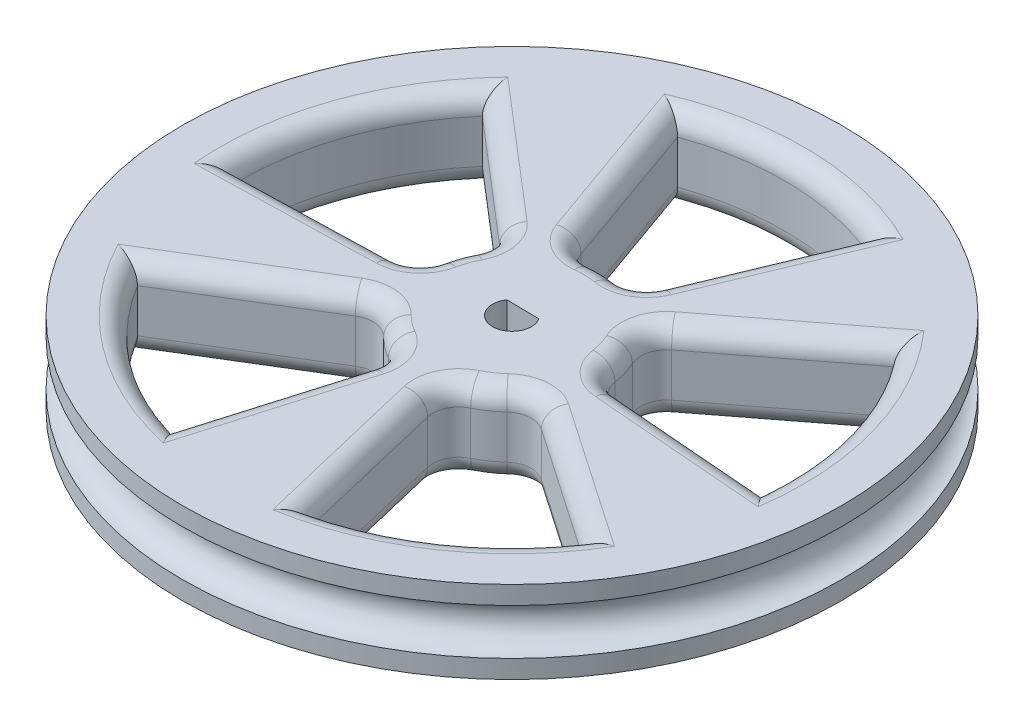
from build123d import *

# Parameters (mm, degrees)
SKETCH1_R           = 25.4
BOSS_EXTRUDE1_DEPTH = 6.35
SKETCH3_R           = 1.7653000000000019
FILLET1_R           = 1.5
FILLET5_R           = 1.5


with BuildPart() as part:
    # Sketch1 → Boss-Extrude1 (new body)
    with BuildSketch(Plane(origin=(0, 0, 0), x_dir=(1, 0, 0), z_dir=(0, 1, 0))):
        with Locations(Location((0, 0, 0), (0, 0, 270))):
            Circle(SKETCH1_R)
        with BuildLine():
            Line((-1.239214046451143, 0.8451914262924021), (1.263436215829662, 0.8085350508976246))
            ThreePointArc((1.263436215829662, 0.8085350508976246), (-0.02196817781749697, -1.4998391244274765), (-1.239214046451143, 0.8451914262924021))
        make_face(mode=Mode.SUBTRACT)
        with BuildLine():
            Line((6.957562998546382, 5.347178426166307), (16.65064569144089, 12.796718253447914))
            ThreePointArc((16.65064569144089, 12.796718253447914), (20.137394289136008, 5.956958220761493), (20.932776346026767, -1.6789504004727618))
            Line((20.932776346026767, -1.6789504004727618), (8.746874617410656, -0.7015585701117318))
            ThreePointArc((8.746874617410656, -0.7015585701117318), (7.538548422866684, -0.16671267846281812), (6.927491398762463, 1.0049193599891764))
            ThreePointArc((6.927491398762463, 1.0049193599891764), (6.712464763045756, 1.9856527402539574), (6.359342943569763, 2.925535391356313))
            ThreePointArc((6.359342943569763, 2.925535391356313), (6.2346640954479655, 4.241045750519349), (6.957562998546382, 5.347178426166307))
        make_face(mode=Mode.SUBTRACT)
        with BuildLine():
            Line((-2.9354636800132026, 8.269404632942047), (-7.02506979616333, 19.7901084979096))
            ThreePointArc((-7.02506979616333, 19.7901084979096), (0.5573931246188307, 20.99260138488386), (8.065360349277938, 19.389429141578542))
            Line((8.065360349277938, 19.389429141578542), (3.370154754114209, 8.101978581391178))
            ThreePointArc((3.370154754114209, 8.101978581391178), (2.4880927547856215, 7.118068550150576), (1.184977464934863, 6.898972996584096))
            ThreePointArc((1.184977464934863, 6.898972996584096), (0.1857977082062769, 6.997533794961285), (-0.8172044549799278, 6.952134699411467))
            ThreePointArc((-0.8172044549799278, 6.952134699411467), (-2.1068570372248887, 7.240073125718787), (-2.9354636800132026, 8.269404632942047))
        make_face(mode=Mode.SUBTRACT)
        with BuildLine():
            Line((7.235474091984142, -4.96466662166111), (17.31573476810607, -11.881301672822806))
            ThreePointArc((17.31573476810607, -11.881301672822806), (11.888200990925402, -17.31099873489043), (4.871806911466461, -20.42707755449627))
            Line((4.871806911466461, -20.42707755449627), (2.0357110547792607, -8.535565622819002))
            ThreePointArc((2.0357110547792607, -8.535565622819002), (2.1709863963831397, -7.22110265179649), (3.09644767627299, -6.277898676158374))
            ThreePointArc((3.09644767627299, -6.277898676158374), (3.962733663642219, -5.770332911630332), (4.747494540223225, -5.14405439226292))
            ThreePointArc((4.747494540223225, -5.14405439226292), (5.960091356650591, -4.618962704054631), (7.235474091984142, -4.96466662166111))
        make_face(mode=Mode.SUBTRACT)
        with BuildLine():
            Line((-2.4857940849808533, -8.415511141165377), (-5.948933064572476, -20.13976651784332))
            ThreePointArc((-5.948933064572476, -20.13976651784332), (-12.79008201165348, -16.65574381813031), (-17.921834088113528, -10.945677819036153))
            Line((-17.921834088113528, -10.945677819036153), (-7.488735994283184, -4.573711097995527))
            ThreePointArc((-7.488735994283184, -4.573711097995527), (-6.196805040788158, -4.296174196598862), (-5.013781490439832, -4.884874119782712))
            ThreePointArc((-5.013781490439832, -4.884874119782712), (-4.2633606705510445, -5.551914606043445), (-3.425229956306851, -6.104735845753053))
            ThreePointArc((-3.425229956306851, -6.104735845753053), (-2.5511250609829195, -7.095721694393666), (-2.4857940849808533, -8.415511141165377))
        make_face(mode=Mode.SUBTRACT)
        with BuildLine():
            Line((-8.771779325535338, -0.23640529628257928), (-20.99237759880964, -0.5657585606915596))
            ThreePointArc((-20.99237759880964, -0.5657585606915596), (-19.792906393025493, 7.017182947375003), (-15.94810951865652, 13.662276632426137))
            Line((-15.94810951865652, 13.662276632426137), (-6.664004432020967, 5.708856709535186))
            ThreePointArc((-6.664004432020967, 5.708856709535186), (-6.000822533246314, 4.565920976708062), (-6.195135049529354, 3.2588804393676236))
            ThreePointArc((-6.195135049529354, 3.2588804393676236), (-6.597635464341803, 2.339060982458413), (-6.864403072504624, 1.3711201472478967))
            ThreePointArc((-6.864403072504624, 1.3711201472478967), (-7.536773353889203, 0.233565522209511), (-8.771779325535338, -0.23640529628257928))
        make_face(mode=Mode.SUBTRACT)
    extrude(amount=BOSS_EXTRUDE1_DEPTH)

    # Sketch3 → Cut-Revolve3 (revolve, cut)
    with BuildSketch(Plane(origin=(0, 0, 0), x_dir=(0.8245587984812139, 0, 0.5657762701344207), z_dir=(-0.5657762701344207, 0, 0.8245587984812139)), mode=Mode.PRIVATE) as cut_revolve3_sk:
        with Locations((-25.399999999999995, 3.175)):
            Circle(SKETCH3_R)
    revolve(cut_revolve3_sk.sketch.rotate(Axis((0, 6.41804163245562, 0), (0, -1, 0)), 235.543785728), axis=Axis((0, 6.41804163245562, 0), (0, -1, 0)), mode=Mode.SUBTRACT)

    # Fillet1
    # the kernel refuses this fillet: 1.5 mm, written as the material it takes off along each edge
    with BuildSketch(Plane(origin=(1.5235424549162517, 6.35, -8.870108138465268), x_dir=(0.9233061495989783, 0, 0.38406477853704474), z_dir=(0.38406477853704474, 0, -0.9233061495989783))) as fillet1_piece_1:
        with BuildLine():
            CenterArc((2.0000000000000018 + FILLET1_R, FILLET1_R), FILLET1_R, 180, 90)
            Line((2.0000000000000018 + FILLET1_R, 0), (2.0000000000000018, 0))
            Line((2.0000000000000018, 0), (2.0000000000000013, FILLET1_R))
        make_face()
    revolve(axis=Axis((1.5235424549162517, 6.35, -8.870108138465268), (0, -1, 0)), revolution_arc=77.16041159309582, mode=Mode.SUBTRACT)
    with BuildSketch(Plane(origin=(9.505603268791855, 6.35, -22.85182720257471), x_dir=(0, -1, 0), z_dir=(-0.3840647785370448, 0, 0.9233061495989783))) as fillet1_piece_2_section:
        with BuildLine():
            CenterArc((FILLET1_R, FILLET1_R), FILLET1_R, 180, 90)
            Line((0, FILLET1_R), (0, 0))
            Line((0, 0), (FILLET1_R, 0))
        make_face()
    fillet1_piece_2 = extrude(amount=15.975035612607877, mode=Mode.PRIVATE)
    fillet1_piece_2 = fillet1_piece_2 & Plane(origin=(-2.44e-15, 6.010300886123182, -2.132e-14), x_dir=(-0.334527133150635, 0, -0.9423861189480761), z_dir=(0, -1, 0)) * Cylinder(20.999999999999982, 38, mode=Mode.PRIVATE)
    add(fillet1_piece_2, mode=Mode.SUBTRACT)
    with BuildSketch(Plane(origin=(-2.44e-15, 6.35, -2.132e-14), x_dir=(-0.334527133150635, 0, -0.9423861189480761), z_dir=(-0.9423861189480761, 0, 0.334527133150635))) as fillet1_piece_3:
        with BuildLine():
            CenterArc((20.999999999999986 + FILLET1_R, FILLET1_R), FILLET1_R, 180, 90)
            Line((20.999999999999986 + FILLET1_R, 0), (20.999999999999986, 0))
            Line((20.999999999999986, 0), (20.999999999999986, FILLET1_R))
        make_face()
    revolve(axis=Axis((-2.44e-15, 6.35, -2.132e-14), (0, -1, 0)), revolution_arc=42.12947856562085, mode=Mode.SUBTRACT)
    with BuildSketch(Plane(origin=(-2.9354636800132026, 6.35, -8.269404632942047), x_dir=(0, -1, 0), z_dir=(-0.3345271331506348, 0, -0.9423861189480762))) as fillet1_piece_4_section:
        with BuildLine():
            CenterArc((FILLET1_R, FILLET1_R), FILLET1_R, 180, 90)
            Line((0, FILLET1_R), (0, 0))
            Line((0, 0), (FILLET1_R, 0))
        make_face()
    fillet1_piece_4 = extrude(amount=15.975035612607877, mode=Mode.PRIVATE)
    fillet1_piece_4 = fillet1_piece_4 & Plane(origin=(-2.44e-15, 6.0102984856456505, -2.132e-14), x_dir=(-0.334527133150635, 0, -0.9423861189480761), z_dir=(0, -1, 0)) * Cylinder(20.999999999999982, 38, mode=Mode.PRIVATE)
    add(fillet1_piece_4, mode=Mode.SUBTRACT)
    with BuildSketch(Plane(origin=(-1.0506914421170503, 6.35, -8.938458899243313), x_dir=(0.11674349356856133, 0, 0.9931620999159237), z_dir=(0.9931620999159237, 0, -0.11674349356856133))) as fillet1_piece_5:
        with BuildLine():
            CenterArc((1.9999999999999993 + FILLET1_R, FILLET1_R), FILLET1_R, 180, 90)
            Line((1.9999999999999993 + FILLET1_R, 0), (1.9999999999999993, 0))
            Line((1.9999999999999993, 0), (1.9999999999999993, FILLET1_R))
        make_face()
    revolve(axis=Axis((-1.0506914421170503, 6.35, -8.938458899243313), (0, -1, 0)), revolution_arc=77.16041159309594, mode=Mode.SUBTRACT)
    with BuildSketch(Plane(origin=(-6.44e-15, 6.35, 1.4166e-13), x_dir=(0.1692824949906922, 0, -0.9855675709405857), z_dir=(0.9855675709405857, 0, 0.1692824949906922))) as fillet1_piece_6:
        with BuildLine():
            CenterArc((7.000000000000141 - FILLET1_R, -FILLET1_R), FILLET1_R, 0, 90)
            Line((7.000000000000141 - FILLET1_R, 0), (7.000000000000141, 0))
            Line((7.000000000000141, 0), (7.000000000000141, -FILLET1_R))
        make_face()
    revolve(axis=Axis((-6.44e-15, 6.35, 1.4166e-13), (0, 1, 0)), revolution_arc=16.450301751812173, mode=Mode.SUBTRACT)
    with BuildSketch(Plane(origin=(8.906774655552294, 6.35, -1.292039177129571), x_dir=(-0.07995001907078597, 0, 0.9967988736202409), z_dir=(0.9967988736202409, 0, 0.07995001907078597))) as fillet1_piece_7:
        with BuildLine():
            CenterArc((2.0000000000008233 + FILLET1_R, FILLET1_R), FILLET1_R, 180, 90)
            Line((2.0000000000008233 + FILLET1_R, 0), (2.0000000000008233, 0))
            Line((2.0000000000008233, 0), (2.0000000000008233, FILLET1_R))
        make_face()
    revolve(axis=Axis((8.906774655552294, 6.35, -1.292039177129571), (0, -1, 0)), revolution_arc=77.16041159304291, mode=Mode.SUBTRACT)
    with BuildSketch(Plane(origin=(24.670772122102868, 6.35, 1.978762971985738), x_dir=(-2e-17, -1, 2.9e-16), z_dir=(-0.9967988736202938, 0, -0.07995001907012703))) as fillet1_piece_8_section:
        with BuildLine():
            CenterArc((FILLET1_R, FILLET1_R), FILLET1_R, 180, 90)
            Line((4.4e-16, FILLET1_R), (0, 0))
            Line((0, 0), (FILLET1_R, 0))
        make_face()
    fillet1_piece_8 = extrude(amount=15.975035612608481, mode=Mode.PRIVATE)
    fillet1_piece_8 = fillet1_piece_8 & Plane(origin=(-7.638e-14, 6.010300885898261, -1.11e-15), x_dir=(0.7928878900685917, 0, -0.6093675358784523), z_dir=(0, -1, 0)) * Cylinder(21.00000000000068, 38, mode=Mode.PRIVATE)
    add(fillet1_piece_8, mode=Mode.SUBTRACT)
    with BuildSketch(Plane(origin=(-7.638e-14, 6.35, -1.11e-15), x_dir=(0.7928878900685917, 0, -0.6093675358784523), z_dir=(-0.6093675358784523, 0, -0.7928878900685917))) as fillet1_piece_9:
        with BuildLine():
            CenterArc((21.00000000000068 + FILLET1_R, FILLET1_R), FILLET1_R, 180, 90)
            Line((21.00000000000068 + FILLET1_R, 0), (21.00000000000068, 0))
            Line((21.00000000000068, 0), (21.000000000000682, FILLET1_R))
        make_face()
    revolve(axis=Axis((-7.638e-14, 6.35, -1.11e-15), (0, -1, 0)), revolution_arc=42.129478565620666, mode=Mode.SUBTRACT)
    with BuildSketch(Plane(origin=(6.957562998546382, 6.35, -5.347178426166307), x_dir=(0, -1, 0), z_dir=(0.792887890068589, 0, -0.6093675358784559))) as fillet1_piece_10_section:
        with BuildLine():
            CenterArc((FILLET1_R, FILLET1_R), FILLET1_R, 180.00000000000003, 90)
            Line((0, FILLET1_R), (0, 0))
            Line((0, 0), (FILLET1_R, 0))
        make_face()
    fillet1_piece_10 = extrude(amount=15.975035612608496, mode=Mode.PRIVATE)
    fillet1_piece_10 = fillet1_piece_10 & Plane(origin=(-7.638e-14, 6.010298485645654, -1.11e-15), x_dir=(0.7928878900685917, 0, -0.6093675358784523), z_dir=(0, -1, 0)) * Cylinder(21.00000000000068, 38, mode=Mode.PRIVATE)
    add(fillet1_piece_10, mode=Mode.SUBTRACT)
    with BuildSketch(Plane(origin=(8.176298070304803, 6.35, -3.7614026460292664), x_dir=(-0.9084775633671516, 0, 0.4179336273363071), z_dir=(0.4179336273363071, 0, 0.9084775633671516))) as fillet1_piece_11:
        with BuildLine():
            CenterArc((2.000000000000812 + FILLET1_R, FILLET1_R), FILLET1_R, 180, 90)
            Line((2.000000000000812 + FILLET1_R, 0), (2.000000000000812, 0))
            Line((2.000000000000812, 0), (2.0000000000008114, FILLET1_R))
        make_face()
    revolve(axis=Axis((8.176298070304803, 6.35, -3.7614026460292664), (0, -1, 0)), revolution_arc=77.16041159304235, mode=Mode.SUBTRACT)
    with BuildSketch(Plane(origin=(4.4365e-13, 6.35, -1.0747e-13), x_dir=(0.9896416283945478, 0, -0.14355990856986317), z_dir=(0.14355990856986317, 0, 0.9896416283945478))) as fillet1_piece_12:
        with BuildLine():
            CenterArc((7.000000000000185 - FILLET1_R, -FILLET1_R), FILLET1_R, 0, 90)
            Line((7.000000000000185 - FILLET1_R, 0), (7.000000000000185, 0))
            Line((7.000000000000185, 0), (7.000000000000185, -FILLET1_R))
        make_face()
    revolve(axis=Axis((4.4365e-13, 6.35, -1.0747e-13), (0, 1, 0)), revolution_arc=16.450301751814376, mode=Mode.SUBTRACT)
    with BuildSketch(Plane(origin=(3.981147012351228, 6.35, 8.071584012204102), x_dir=(-0.9727179787856489, 0, 0.23199080530736996), z_dir=(0.23199080530736996, 0, 0.9727179787856489))) as fillet1_piece_13:
        with BuildLine():
            CenterArc((2.0000000000006883 + FILLET1_R, FILLET1_R), FILLET1_R, 180, 90)
            Line((2.0000000000006883 + FILLET1_R, 0), (2.0000000000006883, 0))
            Line((2.0000000000006883, 0), (2.0000000000006883, FILLET1_R))
        make_face()
    revolve(axis=Axis((3.981147012351228, 6.35, 8.071584012204102), (0, -1, 0)), revolution_arc=77.16041159306168, mode=Mode.SUBTRACT)
    with BuildSketch(Plane(origin=(5.741772431371222, 6.35, 24.074769974941947), x_dir=(0, -1, 0), z_dir=(-0.23199080530793634, 0, -0.9727179787855138))) as fillet1_piece_14_section:
        with BuildLine():
            CenterArc((FILLET1_R, FILLET1_R), FILLET1_R, 180, 90)
            Line((0, FILLET1_R), (0, 0))
            Line((0, 0), (FILLET1_R, 0))
        make_face()
    fillet1_piece_14 = extrude(amount=15.9750356126083, mode=Mode.PRIVATE)
    fillet1_piece_14 = fillet1_piece_14 & Plane(origin=(-1.199e-13, 6.010301653620329, -2.6734e-13), x_dir=(0.8245587984812192, 0, 0.565776270134413), z_dir=(0, -1, 0)) * Cylinder(21.00000000000071, 38, mode=Mode.PRIVATE)
    add(fillet1_piece_14, mode=Mode.SUBTRACT)
    with BuildSketch(Plane(origin=(-1.199e-13, 6.35, -2.6734e-13), x_dir=(0.8245587984812192, 0, 0.565776270134413), z_dir=(0.565776270134413, 0, -0.8245587984812192))) as fillet1_piece_15:
        with BuildLine():
            CenterArc((21.000000000000714 + FILLET1_R, FILLET1_R), FILLET1_R, 180, 90)
            Line((21.000000000000714 + FILLET1_R, 0), (21.000000000000714, 0))
            Line((21.000000000000714, 0), (21.000000000000714, FILLET1_R))
        make_face()
    revolve(axis=Axis((-1.199e-13, 6.35, -2.6734e-13), (0, -1, 0)), revolution_arc=42.129478565620346, mode=Mode.SUBTRACT)
    with BuildSketch(Plane(origin=(7.235474091984142, 6.35, 4.96466662166111), x_dir=(0, -1, 0), z_dir=(0.8245587984812139, 0, 0.5657762701344207))) as fillet1_piece_16_section:
        with BuildLine():
            CenterArc((FILLET1_R, FILLET1_R), FILLET1_R, 180, 90)
            Line((0, FILLET1_R), (0, 0))
            Line((0, 0), (FILLET1_R, 0))
        make_face()
    fillet1_piece_16 = extrude(amount=15.97503561260779, mode=Mode.PRIVATE)
    fillet1_piece_16 = fillet1_piece_16 & Plane(origin=(-1.199e-13, 6.0102984856456505, -2.6734e-13), x_dir=(0.8245587984812192, 0, 0.565776270134413), z_dir=(0, -1, 0)) * Cylinder(21.00000000000071, 38, mode=Mode.PRIVATE)
    add(fillet1_piece_16, mode=Mode.SUBTRACT)
    with BuildSketch(Plane(origin=(6.103921551715461, 6.35, 6.613784218623904), x_dir=(-0.6782135057460461, 0, -0.7348649131804144), z_dir=(-0.7348649131804144, 0, 0.6782135057460461))) as fillet1_piece_17:
        with BuildLine():
            CenterArc((2.000000000000212 + FILLET1_R, FILLET1_R), FILLET1_R, 180, 90)
            Line((2.000000000000212 + FILLET1_R, 0), (2.000000000000212, 0))
            Line((2.000000000000212, 0), (2.000000000000212, FILLET1_R))
        make_face()
    revolve(axis=Axis((6.103921551715461, 6.35, 6.613784218623904), (0, -1, 0)), revolution_arc=77.16041159308413, mode=Mode.SUBTRACT)
    with BuildSketch(Plane(origin=(-2.23044e-12, 6.35, -3.82094e-12), x_dir=(0.44234966803900455, 0, 0.8968426680225369), z_dir=(-0.8968426680225369, 0, 0.44234966803900455))) as fillet1_piece_18:
        with BuildLine():
            CenterArc((7.000000000004946 - FILLET1_R, -FILLET1_R), FILLET1_R, 0, 90)
            Line((7.000000000004946 - FILLET1_R, 0), (7.000000000004946, 0))
            Line((7.000000000004946, 0), (7.000000000004946, -FILLET1_R))
        make_face()
    revolve(axis=Axis((-2.23044e-12, 6.35, -3.82094e-12), (0, 1, 0)), revolution_arc=16.45030175180311, mode=Mode.SUBTRACT)
    with BuildSketch(Plane(origin=(-6.446290487708355, 6.35, 6.280552439720628), x_dir=(-0.5212227532874149, 0, -0.8534206708625511), z_dir=(-0.8534206708625511, 0, 0.5212227532874149))) as fillet1_piece_19:
        with BuildLine():
            CenterArc((1.9999999999999993 + FILLET1_R, FILLET1_R), FILLET1_R, 180, 90)
            Line((1.9999999999999993 + FILLET1_R, 0), (1.9999999999999993, 0))
            Line((1.9999999999999993, 0), (1.9999999999999993, FILLET1_R))
        make_face()
    revolve(axis=Axis((-6.446290487708355, 6.35, 6.280552439720628), (0, -1, 0)), revolution_arc=77.16041159309594, mode=Mode.SUBTRACT)
    with BuildSketch(Plane(origin=(-21.122161603848028, 6.35, 12.900263143864064), x_dir=(5.3e-16, -1, 8.6e-16), z_dir=(0.8534206708625337, 0, -0.5212227532874435))) as fillet1_piece_20_section:
        with BuildLine():
            CenterArc((FILLET1_R, FILLET1_R), FILLET1_R, 180, 90.00000000000006)
            Line((-1.52e-15, FILLET1_R), (0, 0))
            Line((0, 0), (FILLET1_R, 0))
        make_face()
    fillet1_piece_20 = extrude(amount=15.975035612608073, mode=Mode.PRIVATE)
    fillet1_piece_20 = fillet1_piece_20 & Plane(origin=(-2.0961e-13, 6.010301653620333, 1.8829e-13), x_dir=(-0.28328252688439476, 0, 0.9590365008496768), z_dir=(0, -1, 0)) * Cylinder(20.999999999999915, 38, mode=Mode.PRIVATE)
    add(fillet1_piece_20, mode=Mode.SUBTRACT)
    with BuildSketch(Plane(origin=(-2.0961e-13, 6.35, 1.8829e-13), x_dir=(-0.28328252688439476, 0, 0.9590365008496768), z_dir=(0.9590365008496768, 0, 0.28328252688439476))) as fillet1_piece_21:
        with BuildLine():
            CenterArc((20.999999999999915 + FILLET1_R, FILLET1_R), FILLET1_R, 180, 90)
            Line((20.999999999999915 + FILLET1_R, 0), (20.999999999999915, 0))
            Line((20.999999999999915, 0), (20.999999999999915, FILLET1_R))
        make_face()
    revolve(axis=Axis((-2.0961e-13, 6.35, 1.8829e-13), (0, -1, 0)), revolution_arc=42.129478565622115, mode=Mode.SUBTRACT)
    with BuildSketch(Plane(origin=(-2.4857940849808533, 6.35, 8.415511141165377), x_dir=(-2.7e-16, -1, -8e-17), z_dir=(-0.2832825268844254, 0, 0.9590365008496677))) as fillet1_piece_22_section:
        with BuildLine():
            CenterArc((FILLET1_R, FILLET1_R), FILLET1_R, 180.00000000000003, 90)
            Line((-4.3e-16, FILLET1_R), (0, 0))
            Line((0, 0), (FILLET1_R, 0))
        make_face()
    fillet1_piece_22 = extrude(amount=15.97503561260778, mode=Mode.PRIVATE)
    fillet1_piece_22 = fillet1_piece_22 & Plane(origin=(-2.0961e-13, 6.01030096790659, 1.8829e-13), x_dir=(-0.28328252688439476, 0, 0.9590365008496768), z_dir=(0, -1, 0)) * Cylinder(20.999999999999915, 38, mode=Mode.PRIVATE)
    add(fillet1_piece_22, mode=Mode.SUBTRACT)
    with BuildSketch(Plane(origin=(-4.403867086680483, 6.35, 7.848946087396787), x_dir=(0.4893185651867653, 0, -0.8721051208217765), z_dir=(-0.8721051208217765, 0, -0.4893185651867653))) as fillet1_piece_23:
        with BuildLine():
            CenterArc((2.000000000000208 + FILLET1_R, FILLET1_R), FILLET1_R, 180, 90)
            Line((2.000000000000208 + FILLET1_R, 0), (2.000000000000208, 0))
            Line((2.000000000000208, 0), (2.000000000000208, FILLET1_R))
        make_face()
    revolve(axis=Axis((-4.403867086680483, 6.35, 7.848946087396787), (0, -1, 0)), revolution_arc=77.16041159308432, mode=Mode.SUBTRACT)
    with BuildSketch(Plane(origin=(9.43978e-12, 6.35, -1.061506e-11), x_dir=(-0.7162544986341606, 0, 0.697839159969063), z_dir=(-0.697839159969063, 0, -0.7162544986341606))) as fillet1_piece_24:
        with BuildLine():
            CenterArc((7.000000000014168 - FILLET1_R, -FILLET1_R), FILLET1_R, 0, 90)
            Line((7.000000000014168 - FILLET1_R, 0), (7.000000000014168, 0))
            Line((7.000000000014168, 0), (7.000000000014168, -FILLET1_R))
        make_face()
    revolve(axis=Axis((9.43978e-12, 6.35, -1.061506e-11), (0, 1, 0)), revolution_arc=16.450301751783933, mode=Mode.SUBTRACT)
    with BuildSketch(Plane(origin=(-7.965173635109171, 6.35, -4.189989136329801), x_dir=(0.6505846015441016, 0, -0.7594337866026916), z_dir=(-0.7594337866026916, 0, -0.6505846015441016))) as fillet1_piece_25:
        with BuildLine():
            CenterArc((2.000000000000001 + FILLET1_R, FILLET1_R), FILLET1_R, 180, 90)
            Line((2.000000000000001 + FILLET1_R, 0), (2.000000000000001, 0))
            Line((2.000000000000001, 0), (2.0000000000000004, FILLET1_R))
        make_face()
    revolve(axis=Axis((-7.965173635109171, 6.35, -4.189989136329801), (0, -1, 0)), revolution_arc=77.16041159309583, mode=Mode.SUBTRACT)
    with BuildSketch(Plane(origin=(-18.795986218416612, 6.35, -16.10196888821652), x_dir=(0, -1, 0), z_dir=(0.7594337866026915, 0, 0.6505846015441019))) as fillet1_piece_26_section:
        with BuildLine():
            CenterArc((FILLET1_R, FILLET1_R), FILLET1_R, 180, 90)
            Line((0, FILLET1_R), (0, 0))
            Line((0, 0), (FILLET1_R, 0))
        make_face()
    fillet1_piece_26 = extrude(amount=15.975035612607877, mode=Mode.PRIVATE)
    fillet1_piece_26 = fillet1_piece_26 & Plane(origin=(8.349e-14, 6.010301653620337, 5.018e-14), x_dir=(-0.9996370285147442, 0, 0.026940883842452707), z_dir=(0, -1, 0)) * Cylinder(21.000000000000096, 38, mode=Mode.PRIVATE)
    add(fillet1_piece_26, mode=Mode.SUBTRACT)
    with BuildSketch(Plane(origin=(8.349e-14, 6.35, 5.018e-14), x_dir=(-0.9996370285147442, 0, 0.026940883842452707), z_dir=(0.026940883842452707, 0, 0.9996370285147442))) as fillet1_piece_27:
        with BuildLine():
            CenterArc((21.0000000000001 + FILLET1_R, FILLET1_R), FILLET1_R, 180, 89.99999999999972)
            Line((21.0000000000001 + FILLET1_R, 0), (21.0000000000001, 0))
            Line((21.0000000000001, 0), (21.0000000000001, FILLET1_R))
        make_face()
    revolve(axis=Axis((8.349e-14, 6.35, 5.018e-14), (0, -1, 0)), revolution_arc=42.12947856562205, mode=Mode.SUBTRACT)
    with BuildSketch(Plane(origin=(-8.771779325535338, 6.35, 0.23640529628257928), x_dir=(0, -1, 4e-17), z_dir=(-0.9996370285147446, 0, 0.026940883842441494))) as fillet1_piece_28_section:
        with BuildLine():
            CenterArc((FILLET1_R, FILLET1_R), FILLET1_R, 180, 90)
            Line((6e-17, FILLET1_R), (0, 0))
            Line((0, 0), (FILLET1_R, 0))
        make_face()
    fillet1_piece_28 = extrude(amount=15.975035612607913, mode=Mode.PRIVATE)
    fillet1_piece_28 = fillet1_piece_28 & Plane(origin=(8.349e-14, 6.010301240617445, 5.018e-14), x_dir=(-0.9996370285147442, 0, 0.026940883842452707), z_dir=(0, -1, 0)) * Cylinder(21.000000000000096, 38, mode=Mode.PRIVATE)
    add(fillet1_piece_28, mode=Mode.SUBTRACT)
    with BuildSketch(Plane(origin=(-8.825661093221036, 6.35, -1.762868760747771), x_dir=(0.9806290103577732, 0, 0.1958743067498507), z_dir=(0.1958743067498507, 0, -0.9806290103577732))) as fillet1_piece_29:
        with BuildLine():
            CenterArc((2.0000000000008837 + FILLET1_R, FILLET1_R), FILLET1_R, 180, 90)
            Line((2.0000000000008837 + FILLET1_R, 0), (2.0000000000008837, 0))
            Line((2.0000000000008837, 0), (2.0000000000008837, FILLET1_R))
        make_face()
    revolve(axis=Axis((-8.825661093221036, 6.35, -1.762868760747771), (0, -1, 0)), revolution_arc=77.16041159306369, mode=Mode.SUBTRACT)
    with BuildSketch(Plane(origin=(8.527e-14, 6.35, 3.897e-14), x_dir=(-0.8850192927899082, 0, -0.4655543484810885), z_dir=(0.4655543484810885, 0, -0.8850192927899082))) as fillet1_piece_30:
        with BuildLine():
            CenterArc((7.000000000000093 - FILLET1_R, -FILLET1_R), FILLET1_R, 0, 90)
            Line((7.000000000000093 - FILLET1_R, 0), (7.000000000000093, 0))
            Line((7.000000000000093, 0), (7.000000000000093, -FILLET1_R))
        make_face()
    revolve(axis=Axis((8.527e-14, 6.35, 3.897e-14), (0, 1, 0)), revolution_arc=16.450301751812287, mode=Mode.SUBTRACT)
    with BuildSketch(Plane(origin=(-2.44e-15, 6.35, -2.132e-14), x_dir=(-0.334527133150635, 0, -0.9423861189480761), z_dir=(-0.9423861189480761, 0, 0.334527133150635))) as fillet1_piece_31a_section:
        with BuildLine():
            CenterArc((20.999999999999986 + FILLET1_R, FILLET1_R), FILLET1_R, 180, 90)
            Line((20.999999999999986 + FILLET1_R, 0), (20.999999999999986, 0))
            Line((20.999999999999986, 0), (20.999999999999986, FILLET1_R))
        make_face()
    fillet1_piece_31a = revolve(axis=Axis((-2.44e-15, 6.35, -2.132e-14), (0, -1, 0)), revolution_arc=52.36176816763609, mode=Mode.PRIVATE)
    fillet1_piece_31a = split(fillet1_piece_31a, bisect_by=Plane(origin=(8.154162230912576, 6.013302304106203, -19.602912199622914), z_dir=(0.9233061495989783, 0, 0.3840647785370448)), keep=Keep.TOP, mode=Mode.PRIVATE)
    with BuildSketch(Plane(origin=(9.505603268791855, 6.35, -22.85182720257471), x_dir=(0, -1, 0), z_dir=(-0.3840647785370448, 0, 0.9233061495989783))) as fillet1_piece_31b_section:
        with BuildLine():
            CenterArc((FILLET1_R, FILLET1_R), FILLET1_R, 180, 90)
            Line((0, FILLET1_R), (0, 0))
            Line((0, 0), (FILLET1_R, 0))
        make_face()
    fillet1_piece_31b = extrude(amount=15.975035612607877, mode=Mode.PRIVATE)
    fillet1_piece_31b = fillet1_piece_31b - Plane(origin=(-2.44e-15, 6.010753327547738, -2.132e-14), x_dir=(-0.334527133150635, 0, -0.9423861189480761), z_dir=(0, -1, 0)) * Cylinder(20.999999999999982, 38, mode=Mode.PRIVATE)
    fillet1_piece_31 = fillet1_piece_31a & fillet1_piece_31b
    add(fillet1_piece_31, mode=Mode.SUBTRACT)
    with BuildSketch(Plane(origin=(-2.9354636800132026, 6.35, -8.269404632942047), x_dir=(0, -1, 0), z_dir=(-0.3345271331506348, 0, -0.9423861189480762))) as fillet1_piece_32a_section:
        with BuildLine():
            CenterArc((FILLET1_R, FILLET1_R), FILLET1_R, 180, 90)
            Line((0, FILLET1_R), (0, 0))
            Line((0, 0), (FILLET1_R, 0))
        make_face()
    fillet1_piece_32a = extrude(amount=15.975035612607877, mode=Mode.PRIVATE)
    fillet1_piece_32a = fillet1_piece_32a - Plane(origin=(-2.44e-15, 6.010750950515123, -2.132e-14), x_dir=(-0.334527133150635, 0, -0.9423861189480761), z_dir=(0, -1, 0)) * Cylinder(20.999999999999982, 38, mode=Mode.PRIVATE)
    with BuildSketch(Plane(origin=(-2.44e-15, 6.35, -2.132e-14), x_dir=(-0.4966115698760526, 0, -0.8679728962734047), z_dir=(-0.8679728962734047, 0, 0.4966115698760526))) as fillet1_piece_32b_section:
        with BuildLine():
            CenterArc((20.999999999999986 + FILLET1_R, FILLET1_R), FILLET1_R, 180, 90)
            Line((20.999999999999986 + FILLET1_R, 0), (20.999999999999986, 0))
            Line((20.999999999999986, 0), (20.999999999999982, FILLET1_R))
        make_face()
    fillet1_piece_32b = revolve(axis=Axis((-2.44e-15, 6.35, -2.132e-14), (0, -1, 0)), revolution_arc=52.36176816763609, mode=Mode.PRIVATE)
    fillet1_piece_32b = split(fillet1_piece_32b, bisect_by=Plane(origin=(-7.102417786767351, 6.013302304106197, -20.008003148149925), z_dir=(-0.9423861189480762, 0, 0.3345271331506348)), keep=Keep.TOP, mode=Mode.PRIVATE)
    fillet1_piece_32 = fillet1_piece_32a & fillet1_piece_32b
    add(fillet1_piece_32, mode=Mode.SUBTRACT)
    with BuildSketch(Plane(origin=(-7.638e-14, 6.35, -1.11e-15), x_dir=(0.7928878900685917, 0, -0.6093675358784523), z_dir=(-0.6093675358784523, 0, -0.7928878900685917))) as fillet1_piece_33a_section:
        with BuildLine():
            CenterArc((21.00000000000068 + FILLET1_R, FILLET1_R), FILLET1_R, 180, 90)
            Line((21.00000000000068 + FILLET1_R, 0), (21.00000000000068, 0))
            Line((21.00000000000068, 0), (21.000000000000682, FILLET1_R))
        make_face()
    fillet1_piece_33a = revolve(axis=Axis((-7.638e-14, 6.35, -1.11e-15), (0, -1, 0)), revolution_arc=52.36176816763559, mode=Mode.PRIVATE)
    fillet1_piece_33a = split(fillet1_piece_33a, bisect_by=Plane(origin=(21.16325209051122, 6.013302303834896, 1.6974361157503184), z_dir=(-0.07995001907012703, 0, 0.9967988736202938)), keep=Keep.TOP, mode=Mode.PRIVATE)
    with BuildSketch(Plane(origin=(24.670772122102868, 6.35, 1.978762971985738), x_dir=(-2e-17, -1, 2.9e-16), z_dir=(-0.9967988736202938, 0, -0.07995001907012703))) as fillet1_piece_33b_section:
        with BuildLine():
            CenterArc((FILLET1_R, FILLET1_R), FILLET1_R, 180, 90)
            Line((4.4e-16, FILLET1_R), (0, 0))
            Line((0, 0), (FILLET1_R, 0))
        make_face()
    fillet1_piece_33b = extrude(amount=15.975035612608481, mode=Mode.PRIVATE)
    fillet1_piece_33b = fillet1_piece_33b - Plane(origin=(-7.638e-14, 6.0107533273193665, -1.11e-15), x_dir=(0.7928878900685917, 0, -0.6093675358784523), z_dir=(0, -1, 0)) * Cylinder(21.00000000000068, 38, mode=Mode.PRIVATE)
    fillet1_piece_33 = fillet1_piece_33a & fillet1_piece_33b
    add(fillet1_piece_33, mode=Mode.SUBTRACT)
    with BuildSketch(Plane(origin=(6.957562998546382, 6.35, -5.347178426166307), x_dir=(0, -1, 0), z_dir=(0.792887890068589, 0, -0.6093675358784559))) as fillet1_piece_34a_section:
        with BuildLine():
            CenterArc((FILLET1_R, FILLET1_R), FILLET1_R, 180.00000000000003, 90)
            Line((0, FILLET1_R), (0, 0))
            Line((0, 0), (FILLET1_R, 0))
        make_face()
    fillet1_piece_34a = extrude(amount=15.975035612608496, mode=Mode.PRIVATE)
    fillet1_piece_34a = fillet1_piece_34a - Plane(origin=(-7.638e-14, 6.010750950515126, -1.11e-15), x_dir=(0.7928878900685917, 0, -0.6093675358784523), z_dir=(0, -1, 0)) * Cylinder(21.00000000000068, 38, mode=Mode.PRIVATE)
    with BuildSketch(Plane(origin=(-7.638e-14, 6.35, -1.11e-15), x_dir=(0.6720298642734828, 0, -0.7405240452035061), z_dir=(-0.7405240452035061, 0, -0.6720298642734828))) as fillet1_piece_34b_section:
        with BuildLine():
            CenterArc((21.000000000000682 + FILLET1_R, FILLET1_R), FILLET1_R, 180, 90)
            Line((21.000000000000682 + FILLET1_R, 0), (21.000000000000682, 0))
            Line((21.000000000000682, 0), (21.000000000000682, FILLET1_R))
        make_face()
    fillet1_piece_34b = revolve(axis=Axis((-7.638e-14, 6.35, -1.11e-15), (0, -1, 0)), revolution_arc=52.36176816763559, mode=Mode.PRIVATE)
    fillet1_piece_34b = split(fillet1_piece_34b, bisect_by=Plane(origin=(16.833974332503715, 6.013302424089721, -12.937613988721075), z_dir=(-0.6093675358784559, 0, -0.792887890068589)), keep=Keep.TOP, mode=Mode.PRIVATE)
    fillet1_piece_34 = fillet1_piece_34a & fillet1_piece_34b
    add(fillet1_piece_34, mode=Mode.SUBTRACT)
    with BuildSketch(Plane(origin=(-1.199e-13, 6.35, -2.6734e-13), x_dir=(0.8245587984812192, 0, 0.565776270134413), z_dir=(0.565776270134413, 0, -0.8245587984812192))) as fillet1_piece_35a_section:
        with BuildLine():
            CenterArc((21.000000000000714 + FILLET1_R, FILLET1_R), FILLET1_R, 180, 90)
            Line((21.000000000000714 + FILLET1_R, 0), (21.000000000000714, 0))
            Line((21.000000000000714, 0), (21.000000000000714, FILLET1_R))
        make_face()
    fillet1_piece_35a = revolve(axis=Axis((-1.199e-13, 6.35, -2.6734e-13), (0, -1, 0)), revolution_arc=52.36176816763524, mode=Mode.PRIVATE)
    fillet1_piece_35a = split(fillet1_piece_35a, bisect_by=Plane(origin=(4.925446873293165, 6.01330230424303, 20.65198541315449), z_dir=(-0.9727179787855138, 0, 0.23199080530793634)), keep=Keep.TOP, mode=Mode.PRIVATE)
    with BuildSketch(Plane(origin=(5.741772431371222, 6.35, 24.074769974941947), x_dir=(0, -1, 0), z_dir=(-0.23199080530793634, 0, -0.9727179787855138))) as fillet1_piece_35b_section:
        with BuildLine():
            CenterArc((FILLET1_R, FILLET1_R), FILLET1_R, 180, 90)
            Line((0, FILLET1_R), (0, 0))
            Line((0, 0), (FILLET1_R, 0))
        make_face()
    fillet1_piece_35b = extrude(amount=15.9750356126083, mode=Mode.PRIVATE)
    fillet1_piece_35b = fillet1_piece_35b - Plane(origin=(-1.199e-13, 6.010754101042097, -2.6734e-13), x_dir=(0.8245587984812192, 0, 0.565776270134413), z_dir=(0, -1, 0)) * Cylinder(21.00000000000071, 38, mode=Mode.PRIVATE)
    fillet1_piece_35 = fillet1_piece_35a & fillet1_piece_35b
    add(fillet1_piece_35, mode=Mode.SUBTRACT)
    with BuildSketch(Plane(origin=(7.235474091984142, 6.35, 4.96466662166111), x_dir=(0, -1, 0), z_dir=(0.8245587984812139, 0, 0.5657762701344207))) as fillet1_piece_36a_section:
        with BuildLine():
            CenterArc((FILLET1_R, FILLET1_R), FILLET1_R, 180, 90)
            Line((0, FILLET1_R), (0, 0))
            Line((0, 0), (FILLET1_R, 0))
        make_face()
    fillet1_piece_36a = extrude(amount=15.97503561260779, mode=Mode.PRIVATE)
    fillet1_piece_36a = fillet1_piece_36a - Plane(origin=(-1.199e-13, 6.010750950515123, -2.6734e-13), x_dir=(0.8245587984812192, 0, 0.565776270134413), z_dir=(0, -1, 0)) * Cylinder(21.00000000000071, 38, mode=Mode.PRIVATE)
    with BuildSketch(Plane(origin=(-1.199e-13, 6.35, -2.6734e-13), x_dir=(0.9119488674520412, 0, 0.41030386685106846), z_dir=(0.41030386685106846, 0, -0.9119488674520412))) as fillet1_piece_36b_section:
        with BuildLine():
            CenterArc((21.00000000000071 + FILLET1_R, FILLET1_R), FILLET1_R, 180, 90)
            Line((21.00000000000071 + FILLET1_R, 0), (21.00000000000071, 0))
            Line((21.00000000000071, 0), (21.000000000000714, FILLET1_R))
        make_face()
    fillet1_piece_36b = revolve(axis=Axis((-1.199e-13, 6.35, -2.6734e-13), (0, -1, 0)), revolution_arc=52.36176816763524, mode=Mode.PRIVATE)
    fillet1_piece_36b = split(fillet1_piece_36b, bisect_by=Plane(origin=(17.506386240889668, 6.013302424270913, 12.012118394887771), z_dir=(0.5657762701344207, 0, -0.8245587984812139)), keep=Keep.TOP, mode=Mode.PRIVATE)
    fillet1_piece_36 = fillet1_piece_36a & fillet1_piece_36b
    add(fillet1_piece_36, mode=Mode.SUBTRACT)
    with BuildSketch(Plane(origin=(-2.0961e-13, 6.35, 1.8829e-13), x_dir=(-0.28328252688439476, 0, 0.9590365008496768), z_dir=(0.9590365008496768, 0, 0.28328252688439476))) as fillet1_piece_37a_section:
        with BuildLine():
            CenterArc((20.999999999999915 + FILLET1_R, FILLET1_R), FILLET1_R, 180, 90)
            Line((20.999999999999915 + FILLET1_R, 0), (20.999999999999915, 0))
            Line((20.999999999999915, 0), (20.999999999999915, FILLET1_R))
        make_face()
    fillet1_piece_37a = revolve(axis=Axis((-2.0961e-13, 6.35, 1.8829e-13), (0, -1, 0)), revolution_arc=52.3617681676374, mode=Mode.PRIVATE)
    fillet1_piece_37a = split(fillet1_piece_37a, bisect_by=Plane(origin=(-18.119158513108793, 6.01330230426907, 11.066192804902322), z_dir=(-0.5212227532874435, 0, -0.8534206708625336)), keep=Keep.TOP, mode=Mode.PRIVATE)
    with BuildSketch(Plane(origin=(-21.122161603848028, 6.35, 12.900263143864064), x_dir=(5.3e-16, -1, 8.6e-16), z_dir=(0.8534206708625337, 0, -0.5212227532874435))) as fillet1_piece_37b_section:
        with BuildLine():
            CenterArc((FILLET1_R, FILLET1_R), FILLET1_R, 180, 90.00000000000006)
            Line((-1.52e-15, FILLET1_R), (0, 0))
            Line((0, 0), (FILLET1_R, 0))
        make_face()
    fillet1_piece_37b = extrude(amount=15.975035612608073, mode=Mode.PRIVATE)
    fillet1_piece_37b = fillet1_piece_37b - Plane(origin=(-2.0961e-13, 6.010754101042101, 1.8829e-13), x_dir=(-0.28328252688439476, 0, 0.9590365008496768), z_dir=(0, -1, 0)) * Cylinder(20.999999999999915, 38, mode=Mode.PRIVATE)
    fillet1_piece_37 = fillet1_piece_37a & fillet1_piece_37b
    add(fillet1_piece_37, mode=Mode.SUBTRACT)
    with BuildSketch(Plane(origin=(-2.4857940849808533, 6.35, 8.415511141165377), x_dir=(-2.7e-16, -1, -8e-17), z_dir=(-0.2832825268844254, 0, 0.9590365008496677))) as fillet1_piece_38a_section:
        with BuildLine():
            CenterArc((FILLET1_R, FILLET1_R), FILLET1_R, 180.00000000000003, 90)
            Line((-4.3e-16, FILLET1_R), (0, 0))
            Line((0, 0), (FILLET1_R, 0))
        make_face()
    fillet1_piece_38a = extrude(amount=15.97503561260778, mode=Mode.PRIVATE)
    fillet1_piece_38a = fillet1_piece_38a - Plane(origin=(-2.0961e-13, 6.010753424621997, 1.8829e-13), x_dir=(-0.28328252688439476, 0, 0.9590365008496768), z_dir=(0, -1, 0)) * Cylinder(20.999999999999915, 38, mode=Mode.PRIVATE)
    with BuildSketch(Plane(origin=(-2.0961e-13, 6.35, 1.8829e-13), x_dir=(-0.1084144681861116, 0, 0.994105780632988), z_dir=(0.994105780632988, 0, 0.1084144681861116))) as fillet1_piece_38b_section:
        with BuildLine():
            CenterArc((20.99999999999992 + FILLET1_R, FILLET1_R), FILLET1_R, 180, 90)
            Line((20.99999999999992 + FILLET1_R, 0), (20.99999999999992, 0))
            Line((20.99999999999992, 0), (20.999999999999915, FILLET1_R))
        make_face()
    fillet1_piece_38b = revolve(axis=Axis((-2.0961e-13, 6.35, 1.8829e-13), (0, -1, 0)), revolution_arc=52.3617681676374, mode=Mode.PRIVATE)
    fillet1_piece_38b = split(fillet1_piece_38b, bisect_by=Plane(origin=(-6.014432615428062, 6.013302424010157, 20.36151143360155), z_dir=(0.9590365008496677, 0, 0.2832825268844254)), keep=Keep.TOP, mode=Mode.PRIVATE)
    fillet1_piece_38 = fillet1_piece_38a & fillet1_piece_38b
    add(fillet1_piece_38, mode=Mode.SUBTRACT)
    with BuildSketch(Plane(origin=(8.349e-14, 6.35, 5.018e-14), x_dir=(-0.9996370285147442, 0, 0.026940883842452707), z_dir=(0.026940883842452707, 0, 0.9996370285147442))) as fillet1_piece_39a_section:
        with BuildLine():
            CenterArc((21.0000000000001 + FILLET1_R, FILLET1_R), FILLET1_R, 180, 89.99999999999972)
            Line((21.0000000000001 + FILLET1_R, 0), (21.0000000000001, 0))
            Line((21.0000000000001, 0), (21.0000000000001, FILLET1_R))
        make_face()
    fillet1_piece_39a = revolve(axis=Axis((8.349e-14, 6.35, 5.018e-14), (0, -1, 0)), revolution_arc=52.36176816763725, mode=Mode.PRIVATE)
    fillet1_piece_39a = split(fillet1_piece_39a, bisect_by=Plane(origin=(-16.123702681843042, 6.013302304327411, -13.812702133794222), z_dir=(0.6505846015441019, 0, -0.7594337866026915)), keep=Keep.TOP, mode=Mode.PRIVATE)
    with BuildSketch(Plane(origin=(-18.795986218416612, 6.35, -16.10196888821652), x_dir=(0, -1, 0), z_dir=(0.7594337866026915, 0, 0.6505846015441019))) as fillet1_piece_39b_section:
        with BuildLine():
            CenterArc((FILLET1_R, FILLET1_R), FILLET1_R, 180, 90)
            Line((0, FILLET1_R), (0, 0))
            Line((0, 0), (FILLET1_R, 0))
        make_face()
    fillet1_piece_39b = extrude(amount=15.975035612607877, mode=Mode.PRIVATE)
    fillet1_piece_39b = fillet1_piece_39b - Plane(origin=(8.349e-14, 6.010754101042106, 5.018e-14), x_dir=(-0.9996370285147442, 0, 0.026940883842452707), z_dir=(0, -1, 0)) * Cylinder(21.000000000000096, 38, mode=Mode.PRIVATE)
    fillet1_piece_39 = fillet1_piece_39a & fillet1_piece_39b
    add(fillet1_piece_39, mode=Mode.SUBTRACT)
    with BuildSketch(Plane(origin=(-8.771779325535338, 6.35, 0.23640529628257928), x_dir=(0, -1, 4e-17), z_dir=(-0.9996370285147446, 0, 0.026940883842441494))) as fillet1_piece_40a_section:
        with BuildLine():
            CenterArc((FILLET1_R, FILLET1_R), FILLET1_R, 180, 90)
            Line((6e-17, FILLET1_R), (0, 0))
            Line((0, 0), (FILLET1_R, 0))
        make_face()
    fillet1_piece_40a = extrude(amount=15.975035612607913, mode=Mode.PRIVATE)
    fillet1_piece_40a = fillet1_piece_40a - Plane(origin=(8.349e-14, 6.010753680073548, 5.018e-14), x_dir=(-0.9996370285147442, 0, 0.026940883842452707), z_dir=(0, -1, 0)) * Cylinder(21.000000000000096, 38, mode=Mode.PRIVATE)
    with BuildSketch(Plane(origin=(8.349e-14, 6.35, 5.018e-14), x_dir=(-0.9789526936633189, 0, 0.20408729399287032), z_dir=(0.20408729399287032, 0, 0.9789526936633189))) as fillet1_piece_40b_section:
        with BuildLine():
            CenterArc((21.0000000000001 + FILLET1_R, FILLET1_R), FILLET1_R, 180, 90)
            Line((21.0000000000001 + FILLET1_R, 0), (21.0000000000001, 0))
            Line((21.0000000000001, 0), (21.0000000000001, FILLET1_R))
        make_face()
    fillet1_piece_40b = revolve(axis=Axis((8.349e-14, 6.35, 5.018e-14), (0, -1, 0)), revolution_arc=52.36176816763725, mode=Mode.PRIVATE)
    fillet1_piece_40b = split(fillet1_piece_40b, bisect_by=Plane(origin=(-21.223510020239452, 6.013302424002874, 0.5719877334216001), z_dir=(0.026940883842441494, 0, 0.9996370285147446)), keep=Keep.TOP, mode=Mode.PRIVATE)
    fillet1_piece_40 = fillet1_piece_40a & fillet1_piece_40b
    add(fillet1_piece_40, mode=Mode.SUBTRACT)

    # Fillet5
    fillet5_edges = [part.edges().sort_by_distance(p)[0] for p in [
        (0.5573931246188304, 0, -20.992601384883862),
        (-4.980266738088266, 0, -14.029756565425824),
        (-2.106857037224888, 0, -7.240073125718787),
        (0.18579770820627628, 0, -6.997533794961285),
        (7.538548422866766, 0, 0.16671267846289406),
        (14.839825481718712, 0, 1.1902544852922468),
        (20.13739428913601, 0, -5.956958220761493),
        (11.804104344993636, 0, -9.071948339807111),
        (6.234664095447992, 0, -4.241045750519457),
        (6.712464763045757, 0, -1.9856527402539577),
        (2.1709863963830998, 0, 7.221102651796575),
        (3.4537589831228606, 0, 14.481321588657636),
        (11.888200990925409, 0, 17.31099873489043),
        (12.275604430045107, 0, 8.422984147241959),
        (5.96009135665062, 0, 4.6189627040546295),
        (3.962733663642222, 0, 5.770332911630331),
        (-6.196805040788158, 0, 4.296174196598862),
        (-12.705285041198357, 0, 7.75969445851584),
        (-12.790082011653483, 0, 16.655743818130308),
        (-4.217363574776664, 0, 14.277638829504347),
        (-2.551125060982909, 0, 7.095721694393693),
        (-4.263360670551037, 0, 5.55191460604345),
        (-6.000822533246314, 0, -4.565920976708062),
        (-11.306056975338743, 0, -9.685566670980661),
        (-19.792906393025497, 0, -7.017182947374998),
        (-14.882078462172489, 0, 0.4010819284870695),
        (-7.536773353889255, 0, -0.23356552220946725),
        (-6.597635464341803, 0, -2.339060982458414),
        (2.4880927547856215, 0, -7.118068550150576),
        (5.717757551696073, 0, -13.74570386148486),
    ]]
    fillet(fillet5_edges, radius=FILLET5_R)


solid = part.part
